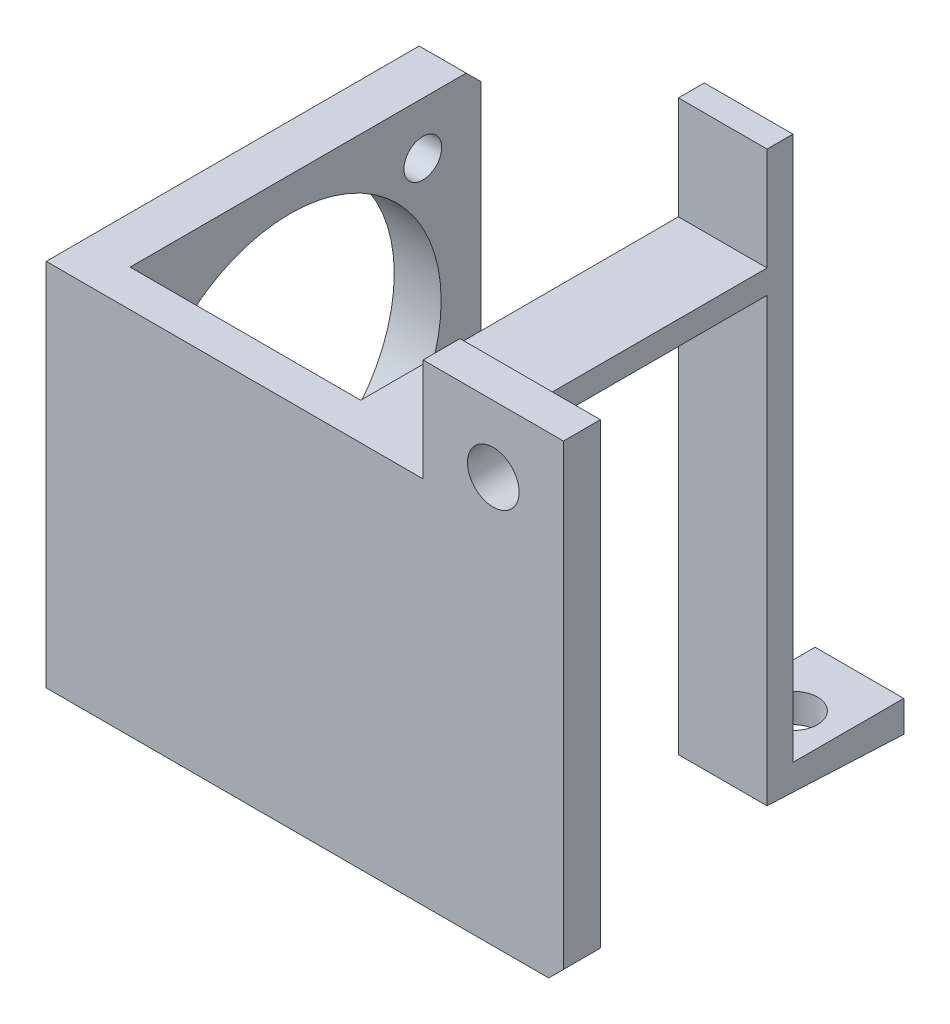
from build123d import *

# Parameters (mm, degrees)
BOSS_EXTRUDE1_DEPTH   = 5
SKETCH2_W             = 6.35
SKETCH2_H             = 50
BOSS_EXTRUDE2_DEPTH   = 52.48
CUT_EXTRUDE1_REACH    = 106.448
SKETCH3_R             = 20.44
SKETCH3_R_2           = 2.555
SKETCH3_W             = 5
SKETCH3_H             = 50
CUT_EXTRUDE2_REACH    = 108.104
SKETCH4_R             = 3.5
CUT_EXTRUDE6_REACH    = 108.104
SKETCH14_W            = 23.196263878
SKETCH14_H            = 15.316152196
SKETCH15_W            = 12
SKETCH15_H            = 3.2
BOSS_EXTRUDE7_DEPTH   = 46.5
BOSS_EXTRUDE8_REACH   = 98.667
SKETCH16_W            = 12
SKETCH16_H            = 3.5
SKETCH17_W            = 12
SKETCH17_H            = 3.5
BOSS_EXTRUDE9_DEPTH   = 15
CHAMFER2_SIZE         = 2
SKETCH22_W            = 12
SKETCH22_H            = 15
BOSS_EXTRUDE10_DEPTH  = 0.72
CUT_EXTRUDE8_REACH    = 103.606
CUT_EXTRUDE7_REACH    = 120.762
SKETCH18_R            = 3.25
MIRROR2_OUTLINE_W     = 50
MIRROR2_OUTLINE_H     = 5
MIRROR2_DEPTH         = 68
MIRROR2_2_OUTLINE_R   = 2.555
MIRROR2_2_OUTLINE_R_2 = 20.44
MIRROR2_2_DEPTH       = 6.35
MIRROR2_START         = 37.56
MIRROR2_3_DEPTH       = 12
MIRROR2_START_2       = 51
MIRROR2_4_OUTLINE_W   = 13.938985111
MIRROR2_4_OUTLINE_H   = 5
MIRROR2_4_DEPTH       = 5.9999999
MIRROR2_START_3       = 64.0000001
MIRROR2_5_OUTLINE_W   = 13.938985111
MIRROR2_5_OUTLINE_H   = 5
MIRROR2_5_DEPTH       = 5.9999999
MIRROR2_6_DEPTH       = 5
BOSS_EXTRUDE11_DEPTH  = 12
CUT_EXTRUDE9_REACH    = 132.799
SKETCH26_W            = 121.241742099
SKETCH26_H            = 103.992632166
SKETCH27_R            = 3.25
CUT_EXTRUDE10_DEPTH   = 119.762181294


with BuildPart() as part:
    # Sketch1 → Boss-Extrude1 (new body)
    with BuildSketch(Plane.XY):
        Polygon((0, 0), (0, 50), (51, 50), (51, 64.061014889), (70, 64.061014889), (70, -13.938985111), (51, -13.938985111), (51, 0), align=None)
    extrude(amount=BOSS_EXTRUDE1_DEPTH)

    # Sketch2 → Boss-Extrude2 (add)
    with BuildSketch(Plane(origin=(0, 0, 0), x_dir=(-1, 0, 0), z_dir=(0, 0, -1))):
        with Locations((-3.175, 25)):
            Rectangle(SKETCH2_W, SKETCH2_H)
    extrude(amount=BOSS_EXTRUDE2_DEPTH)

    # Sketch3 → Cut-Extrude1 (cut, up to next)
    with BuildSketch(Plane(origin=(6.35, 0, 0), x_dir=(0, 0, -1), z_dir=(1, 0, 0)), mode=Mode.PRIVATE) as cut_extrude1_sk1:
        with Locations((21.66, 25)):
            Circle(SKETCH3_R)
    cut_extrude1_tool1 = extrude(cut_extrude1_sk1.sketch, amount=-CUT_EXTRUDE1_REACH, mode=Mode.PRIVATE) & part.part
    # Sketch3 → Cut-Extrude1 (cut, up to next)
    with BuildSketch(Plane(origin=(6.35, 0, 0), x_dir=(0, 0, -1), z_dir=(1, 0, 0)), mode=Mode.PRIVATE) as cut_extrude1_sk2:
        with Locations((3.695, 42.955)):
            Circle(SKETCH3_R_2)
    cut_extrude1_tool2 = extrude(cut_extrude1_sk2.sketch, amount=-CUT_EXTRUDE1_REACH, mode=Mode.PRIVATE) & part.part
    # Sketch3 → Cut-Extrude1 (cut, up to next)
    with BuildSketch(Plane(origin=(6.35, 0, 0), x_dir=(0, 0, -1), z_dir=(1, 0, 0)), mode=Mode.PRIVATE) as cut_extrude1_sk3:
        with Locations((39.615, 7.045)):
            Circle(SKETCH3_R_2)
    cut_extrude1_tool3 = extrude(cut_extrude1_sk3.sketch, amount=-CUT_EXTRUDE1_REACH, mode=Mode.PRIVATE) & part.part
    # Sketch3 → Cut-Extrude1 (cut, up to next)
    with BuildSketch(Plane(origin=(6.35, 0, 0), x_dir=(0, 0, -1), z_dir=(1, 0, 0)), mode=Mode.PRIVATE) as cut_extrude1_sk4:
        with Locations((49.98, 25)):
            Rectangle(SKETCH3_W, SKETCH3_H)
    cut_extrude1_tool4 = extrude(cut_extrude1_sk4.sketch, amount=-CUT_EXTRUDE1_REACH, mode=Mode.PRIVATE) & part.part
    add(cut_extrude1_tool1.solids().sort_by_distance((6.35, 25, -21.66))[0], mode=Mode.SUBTRACT)
    add(cut_extrude1_tool2.solids().sort_by_distance((6.35, 42.955, -3.695))[0], mode=Mode.SUBTRACT)
    add(cut_extrude1_tool3.solids().sort_by_distance((6.35, 7.045, -39.615))[0], mode=Mode.SUBTRACT)
    add(cut_extrude1_tool4.solids().sort_by_distance((6.35, 25, -49.98))[0], mode=Mode.SUBTRACT)

    # Sketch4 → Cut-Extrude2 (cut, up to next)
    with BuildSketch(Plane(origin=(0, 0, 0), x_dir=(-1, 0, 0), z_dir=(0, 0, -1)), mode=Mode.PRIVATE) as cut_extrude2_sk1:
        with Locations((-60.5, 55.061014889)):
            Circle(SKETCH4_R)
    cut_extrude2_tool1 = extrude(cut_extrude2_sk1.sketch, amount=-CUT_EXTRUDE2_REACH, mode=Mode.PRIVATE) & part.part
    # Sketch4 → Cut-Extrude2 (cut, up to next)
    with BuildSketch(Plane(origin=(0, 0, 0), x_dir=(-1, 0, 0), z_dir=(0, 0, -1)), mode=Mode.PRIVATE) as cut_extrude2_sk2:
        with Locations((-60.5, -4.938985111)):
            Circle(SKETCH4_R)
    cut_extrude2_tool2 = extrude(cut_extrude2_sk2.sketch, amount=-CUT_EXTRUDE2_REACH, mode=Mode.PRIVATE) & part.part
    add(cut_extrude2_tool1.solids().sort_by_distance((60.5, 55.061015, 0))[0], mode=Mode.SUBTRACT)
    add(cut_extrude2_tool2.solids().sort_by_distance((60.5, -4.938985, 0))[0], mode=Mode.SUBTRACT)

    # Sketch14 → Cut-Extrude6 (cut, up to next)
    with BuildSketch(Plane(origin=(0, 0, 0), x_dir=(-1, 0, 0), z_dir=(0, 0, -1)), mode=Mode.PRIVATE) as cut_extrude6_sk1:
        with Locations((-62.598131939, 57.658076098)):
            Rectangle(SKETCH14_W, SKETCH14_H)
    cut_extrude6_tool1 = extrude(cut_extrude6_sk1.sketch, amount=-CUT_EXTRUDE6_REACH, mode=Mode.PRIVATE) & part.part
    add(cut_extrude6_tool1.solids().sort_by_distance((62.598132, 57.658076, 0))[0], mode=Mode.SUBTRACT)

    # Sketch15 → Boss-Extrude7 (add)
    with BuildSketch(Plane(origin=(0, 0, 0), x_dir=(-1, 0, 0), z_dir=(0, 0, -1))):
        with Locations((-43.56, 1.6)):
            Rectangle(SKETCH15_W, SKETCH15_H)
    extrude(amount=BOSS_EXTRUDE7_DEPTH)

    # Boss-Extrude8: up to this plane
    boss_extrude8_end = Plane(origin=(166.832994776, 64.085435133, -66.619565524), z_dir=(-1.1416993347548052e-15, 0.9990256874715413, 0.04413247978546202))
    # Sketch16 → Boss-Extrude8 (add, up to the surface)
    with BuildSketch(Plane(origin=(0, 3.2, 0), x_dir=(1, 0, 0), z_dir=(0, 1, 0)), mode=Mode.PRIVATE) as boss_extrude8_sk1:
        with Locations((43.56, 44.75)):
            Rectangle(SKETCH16_W, SKETCH16_H)
    boss_extrude8_tool1 = split(extrude(boss_extrude8_sk1.sketch, amount=BOSS_EXTRUDE8_REACH, mode=Mode.PRIVATE), bisect_by=boss_extrude8_end, keep=Keep.BOTH, mode=Mode.PRIVATE)
    add(boss_extrude8_tool1.solids().sort_by_distance((43.56, 3.2, -44.75))[0])

    # Sketch17 → Boss-Extrude9 (add)
    with BuildSketch(Plane(origin=(0, 0, -46.5), x_dir=(-1, 0, 0), z_dir=(0, 0, -1))):
        with Locations((-43.56, 61.446642853)):
            Rectangle(SKETCH17_W, SKETCH17_H)
    extrude(amount=BOSS_EXTRUDE9_DEPTH)

    # Chamfer2
    chamfer2_edges = [part.edges().sort_by_distance(p)[0] for p in [
        (3.175, 0, -47.48),
        (3.175, 50, -47.48),
        (70, 50, 2.5),
    ]]
    chamfer(chamfer2_edges, length=CHAMFER2_SIZE)

    # Sketch22 → Boss-Extrude10 (add)
    with BuildSketch(Plane(origin=(0, 63.196642853, 0), x_dir=(1, 0, 0), z_dir=(0, 1, 0))):
        with Locations((43.56, 54)):
            Rectangle(SKETCH22_W, SKETCH22_H)
    extrude(amount=BOSS_EXTRUDE10_DEPTH)

    # Sketch23 → Cut-Extrude8 (cut, up to next)
    with BuildSketch(Plane(origin=(49.56, 0, 0), x_dir=(0, 0, -1), z_dir=(1, 0, 0)), mode=Mode.PRIVATE) as cut_extrude8_sk1:
        Polygon((46.5, 63.916642853), (46.5, 63.196642853), (61.5, 63.916642853), align=None)
    cut_extrude8_tool1 = extrude(cut_extrude8_sk1.sketch, amount=-CUT_EXTRUDE8_REACH, mode=Mode.PRIVATE) & part.part
    add(cut_extrude8_tool1.solids().sort_by_distance((49.56, 63.676643, -51.5))[0], mode=Mode.SUBTRACT)

    # Cut-Extrude7: up to this plane
    cut_extrude7_end = Plane(origin=(-0.001, 63.196642853, -46.5), z_dir=(-2.1659106514416256e-15, -0.9988499868416298, -0.04794479936839813))
    # Sketch18 → Cut-Extrude7 (cut, up to the surface)
    with BuildSketch(Plane.XZ.offset(-59.696642853), mode=Mode.PRIVATE) as cut_extrude7_sk1:
        with Locations(Location((43.56, -52.57, 0), (0, 0, 270))):
            Circle(SKETCH18_R)
    cut_extrude7_tool1 = split(extrude(cut_extrude7_sk1.sketch, amount=-CUT_EXTRUDE7_REACH, mode=Mode.PRIVATE), bisect_by=cut_extrude7_end, keep=Keep.BOTH, mode=Mode.PRIVATE)
    add(cut_extrude7_tool1.solids().sort_by_distance((43.56, 59.696643, -52.57))[0], mode=Mode.SUBTRACT)



with BuildPart() as body_2:
    # Mirror2: read off the stored shape, not the designer's step
    # Mirror2 outline → Mirror2 (new body)
    with BuildSketch(Plane.YZ):
        with Locations((-52.877970222, 2.5)):
            Rectangle(MIRROR2_OUTLINE_W, MIRROR2_OUTLINE_H)
    extrude(amount=MIRROR2_DEPTH)

    # Mirror2 2 outline → Mirror2 2 (add)
    with BuildSketch(Plane.YZ):
        Polygon((-27.877970222, -45.48), (-27.877970222, 0), (-77.877970222, 0), (-77.877970222, -45.48), (-75.877970222, -47.48), (-29.877970222, -47.48), align=None)
        with Locations((-34.922970222, -39.615)):
            Circle(MIRROR2_2_OUTLINE_R, mode=Mode.SUBTRACT)
        with Locations((-70.832970222, -3.695)):
            Circle(MIRROR2_2_OUTLINE_R, mode=Mode.SUBTRACT)
        with Locations((-52.877970222, -21.66)):
            Circle(MIRROR2_2_OUTLINE_R_2, mode=Mode.SUBTRACT)
    extrude(amount=MIRROR2_2_DEPTH)


with BuildPart() as part_1:
    add(part.part)

    add(body_2.part)  # Mirror2 3 merges body 2
    # Mirror2 3 outline → Mirror2 3 (add)
    with BuildSketch(Plane.YZ.offset(MIRROR2_START)):
        Polygon((-31.077970222, -46.5), (0, -46.5), (0, -43), (-27.877970222, -43), (-27.877970222, 0), (-31.077970222, 0), align=None)
    extrude(amount=MIRROR2_3_DEPTH)

    # Mirror2 4 outline → Mirror2 4 (add)
    with BuildSketch(Plane.YZ.offset(MIRROR2_START_2)):
        with Locations((-20.908477667, 2.5)):
            Rectangle(MIRROR2_4_OUTLINE_W, MIRROR2_4_OUTLINE_H)
    extrude(amount=MIRROR2_4_DEPTH)

    # Mirror2 5 outline → Mirror2 5 (add)
    with BuildSketch(Plane.YZ.offset(MIRROR2_START_3)):
        with Locations((-20.908477667, 2.5)):
            Rectangle(MIRROR2_5_OUTLINE_W, MIRROR2_5_OUTLINE_H)
    extrude(amount=MIRROR2_5_DEPTH)

    # Mirror2 6 outline → Mirror2 6 (add)
    with BuildSketch(Plane.XY):
        Polygon((70, -75.877970222), (70, -27.877970222), (68, -27.877970222), (68, -77.877970222), align=None)
        with BuildLine():
            Line((64.0000001, -27.877970222), (64, -22.938985111))
            ThreePointArc((64, -22.938985111), (60.5, -26.438985111), (57, -22.938985111))
            Line((57, -22.938985111), (56.9999999, -27.877970222))
            Line((56.9999999, -27.877970222), (64.0000001, -27.877970222))
        make_face()
        with BuildLine():
            ThreePointArc((57, -22.938985111), (60.5, -19.438985111), (64, -22.938985111))
            Line((64, -22.938985111), (64.0000001, -13.938985111))
            Line((64.0000001, -13.938985111), (56.9999999, -13.938985111))
            Line((56.9999999, -13.938985111), (57, -22.938985111))
        make_face()
    extrude(amount=MIRROR2_6_DEPTH)

    # Sketch25 → Boss-Extrude11 (add)
    with BuildSketch(Plane(origin=(49.56, 0, 0), x_dir=(0, 0, -1), z_dir=(1, 0, 0))):
        Polygon((43, -13.938985111), (46.5, -13.938985111), (46.5, -87.574613075), (61.5, -87.574613075), (61.5, -91.794613075), (46.5, -91.074613075), (43, -90.919998753), (43, -31.077970222), align=None)
    extrude(amount=-BOSS_EXTRUDE11_DEPTH)

    # Cut-Extrude9: up to this face of the body (flat: up to its plane)
    cut_extrude9_end = Plane(part_1.part.faces().sort_by_distance((0, 0.724855186, -20.24))[0])
    # Sketch26 → Cut-Extrude9 (cut, up to the picked face)
    with BuildSketch(Plane(origin=(70, 0, 0), x_dir=(0, 0, -1), z_dir=(1, 0, 0)), mode=Mode.PRIVATE) as cut_extrude9_sk1:
        with Locations((55.62087105, 38.057330972)):
            Rectangle(SKETCH26_W, SKETCH26_H)
    cut_extrude9_tool1 = split(extrude(cut_extrude9_sk1.sketch, amount=-CUT_EXTRUDE9_REACH, mode=Mode.PRIVATE), bisect_by=cut_extrude9_end, keep=Keep.BOTH, mode=Mode.PRIVATE)
    add(cut_extrude9_tool1.solids().sort_by(Axis((70, 38.057331, -55.620871), (-1, 0, 0)))[0], mode=Mode.SUBTRACT)

    # Sketch27 → Cut-Extrude10 (cut, through all)
    with BuildSketch(Plane(origin=(0, -87.574613075, 0), x_dir=(1, 0, 0), z_dir=(0, 1, 0))):
        with Locations(Location((43.56, 52.57, 0), (0, 0, 180))):
            Circle(SKETCH27_R)
    extrude(amount=-CUT_EXTRUDE10_DEPTH, mode=Mode.SUBTRACT)


solid = part_1.part
